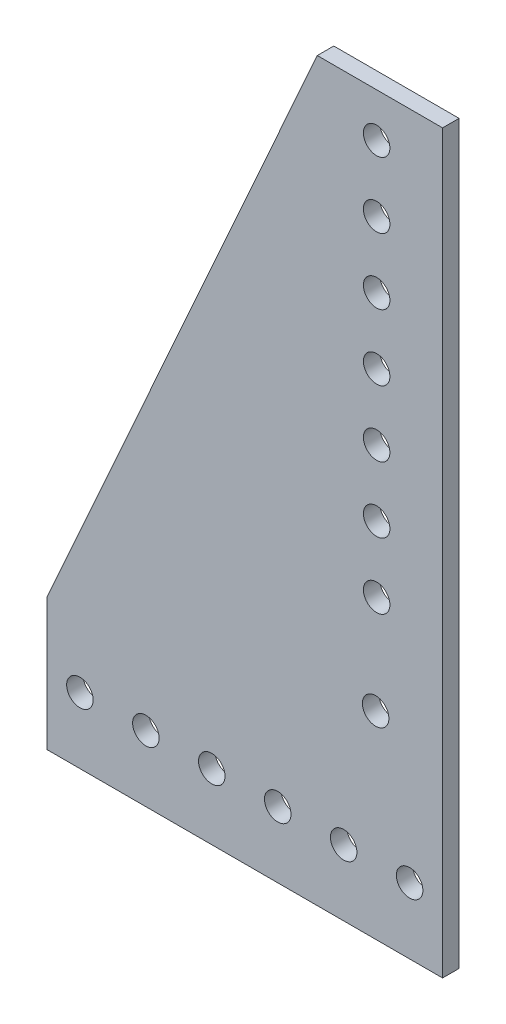
from build123d import *

# Parameters (mm, degrees)
SKETCH1_W           = 177.8
SKETCH1_H           = 254
BOSS_EXTRUDE1_DEPTH = 3.175
SKETCH2_R           = 2.5527
CUT_EXTRUDE1_DEPTH  = 189.739304517
SKETCH3_R           = 2.5527
CUT_EXTRUDE2_DEPTH  = 189.739304517
CUT_EXTRUDE3_DEPTH  = 189.739304517


with BuildPart() as part:
    # Sketch1 → Boss-Extrude1 (new body)
    with BuildSketch(Plane.XY):
        with Locations((-39.1, 11.666666667)):
            Rectangle(SKETCH1_W, SKETCH1_H)
    extrude(amount=BOSS_EXTRUDE1_DEPTH)

    # Sketch2 → Cut-Extrude1 (cut, through all)
    with BuildSketch(Plane.XY.offset(3.175)):
        with Locations((-39.1, -58.183333333)):
            Circle(SKETCH2_R)
        with Locations((-39.1, -45.483333333)):
            Circle(SKETCH2_R)
        with Locations((-39.1, -32.783333333)):
            Circle(SKETCH2_R)
        with Locations((-39.1, -20.083333333)):
            Circle(SKETCH2_R)
        with Locations((-39.1, -7.383333333)):
            Circle(SKETCH2_R)
        with Locations((-39.1, 5.316666667)):
            Circle(SKETCH2_R)
        with Locations((-39.1, 18.016666667)):
            Circle(SKETCH2_R)
        with Locations((-39.1, 30.716666667)):
            Circle(SKETCH2_R)
        with Locations((-39.2905, -77.233333333)):
            Circle(SKETCH2_R)
    extrude(amount=-CUT_EXTRUDE1_DEPTH, mode=Mode.SUBTRACT)

    # Sketch3 → Cut-Extrude2 (cut, through all)
    with BuildSketch(Plane.XY.offset(3.175)):
        with Locations((30.75, -102.633333333)):
            Circle(SKETCH3_R)
        with Locations((18.05, -102.633333333)):
            Circle(SKETCH3_R)
        with Locations((5.35, -102.633333333)):
            Circle(SKETCH3_R)
        with Locations((-7.35, -102.633333333)):
            Circle(SKETCH3_R)
        with Locations((-20.05, -102.633333333)):
            Circle(SKETCH3_R)
        with Locations((-32.75, -102.633333333)):
            Circle(SKETCH3_R)
        with Locations((-45.45, -102.633333333)):
            Circle(SKETCH3_R)
        with Locations((-58.15, -102.633333333)):
            Circle(SKETCH3_R)
        with Locations((-70.85, -102.633333333)):
            Circle(SKETCH3_R)
        with Locations((-83.55, -102.633333333)):
            Circle(SKETCH3_R)
        with Locations((-96.25, -102.633333333)):
            Circle(SKETCH3_R)
        with Locations((-108.95, -102.633333333)):
            Circle(SKETCH3_R)
    extrude(amount=-CUT_EXTRUDE2_DEPTH, mode=Mode.SUBTRACT)

    # Sketch4 → Cut-Extrude3 (cut, through all)
    with BuildSketch(Plane.XY.offset(3.175)):
        Polygon((-128, -115.333333333), (-102.6, -115.333333333), (-102.6, -89.933333333), (-50.53, 26.464089319), (-26.4, 26.464089319), (-26.4, -89.933333333), (-26.4, -115.333333333), (49.8, -115.333333333), (49.8, 138.666666667), (-128, 138.666666667), align=None)
    extrude(amount=-CUT_EXTRUDE3_DEPTH, mode=Mode.SUBTRACT)


solid = part.part
